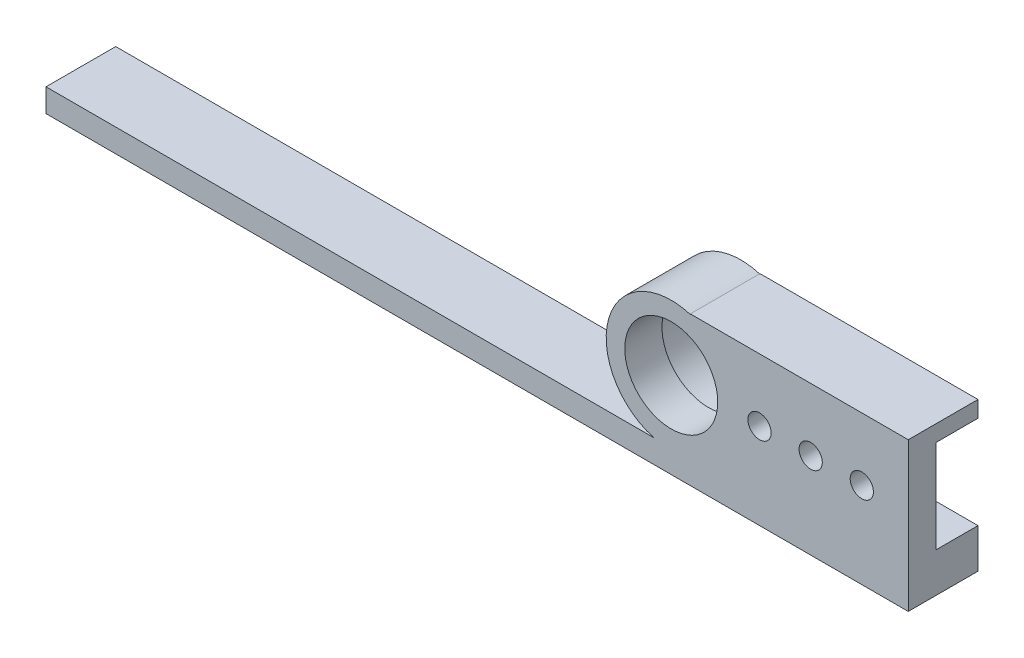
from build123d import *

# Parameters (mm, degrees)
SKETCH_1_W          = 40
SKETCH_1_H          = 20
EXTRUDE_1_DEPTH     = 6
SKETCH_2_R          = 2.5
CUT_EXTRUDE_1_DEPTH = 24.151673806
EXTRUDE_START       = -15
EXTRUDE_2_OUTLINE_R = 11
EXTRUDE_2_DEPTH     = 15
EXTRUDE_START_2     = -8
SKETCH_5_R          = 11
SKETCH_5_R_2        = 10
EXTRUDE_3_DEPTH     = 8
SKETCH_10_W         = 15
SKETCH_10_H         = 5
EXTRUDE_4_DEPTH     = 500
SKETCH_11_W         = 11.491200589
SKETCH_11_H         = 5.122583395
EXTRUDE_5_DEPTH     = 15
SKETCH_13_W         = 324.526705223
SKETCH_13_H         = 235.156452348
CUT_EXTRUDE_2_DEPTH = 482.183177179
SKETCH_14_W         = 2.170521585
SKETCH_14_H         = 5
CUT_EXTRUDE_3_DEPTH = 314.479535155


# Read off the part's stored shape, not the designer's step: 凸台-拉伸2
with BuildPart() as part:
    # 草图1 → 凸台-拉伸1 (new body)
    with BuildSketch(Plane.XY):
        Rectangle(SKETCH_1_W, SKETCH_1_H)
    extrude(amount=EXTRUDE_1_DEPTH)

    # 草图2 → 切除-拉伸1 (cut, through all)
    with BuildSketch(Plane.XY.offset(6)):
        with Locations((10, 0)):
            Circle(SKETCH_2_R)
        with Locations((-1, 0)):
            Circle(SKETCH_2_R)
        with Locations((-12, 0)):
            Circle(SKETCH_2_R)
    extrude(amount=-CUT_EXTRUDE_1_DEPTH, mode=Mode.SUBTRACT)

    # 凸台-拉伸2 outline → 凸台-拉伸2 (add)
    with BuildSketch(Plane.XY.offset(6).offset(EXTRUDE_START)):
        with BuildLine():
            Line((20, 10), (20, 13.5))
            Line((20, 13.5), (-26.893967141, 13.5))
            Line((-26.893967141, 13.5), (-26.893967141, 13.384337644))
            ThreePointArc((-26.893967141, 13.384337644), (-45, 0), (-26.893967141, -13.384337644))
            Line((-26.893967141, -13.384337644), (-26.893967141, -13.5))
            Line((-26.893967141, -13.5), (20, -13.5))
            Line((20, -13.5), (20, -10))
            Line((20, -10), (-20, -10))
            Line((-20, -10), (-20, -8.660254038))
            ThreePointArc((-20, -8.660254038), (-17, 0), (-20, 8.660254038))
            Line((-20, 8.660254038), (-20, 10))
            Line((-20, 10), (20, 10))
        make_face()
        with Locations((-31, 0)):
            Circle(EXTRUDE_2_OUTLINE_R, mode=Mode.SUBTRACT)
    extrude(amount=EXTRUDE_2_DEPTH)

    # 草图5 → 凸台-拉伸3 (add)
    with BuildSketch(Plane.XY.offset(6).offset(EXTRUDE_START_2)):
        with Locations((-31, 0)):
            Circle(SKETCH_5_R)
        with Locations((-31, 0)):
            Circle(SKETCH_5_R_2, mode=Mode.SUBTRACT)
    extrude(amount=EXTRUDE_3_DEPTH)

    # 草图10 → 凸台-拉伸4 (add)
    with BuildSketch(Plane(origin=(20, 0, 0), x_dir=(0, 0, -1), z_dir=(1, 0, 0))):
        with Locations((1.5, -16)):
            Rectangle(SKETCH_10_W, SKETCH_10_H)
    extrude(amount=-EXTRUDE_4_DEPTH)

    # 草图11 → 凸台-拉伸5 (add, through all)
    with BuildSketch(Plane(origin=(0, 0, -9), x_dir=(-1, 0, 0), z_dir=(0, 0, -1))):
        with Locations((27.78271332, -13.925059853)):
            Rectangle(SKETCH_11_W, SKETCH_11_H)
    extrude(amount=-EXTRUDE_5_DEPTH)

    # 草图13 → 切除-拉伸2 (cut, through all)
    with BuildSketch(Plane.XZ.offset(18.5)):
        with Locations((-327.783817457, -102.630695063)):
            Rectangle(SKETCH_13_W, SKETCH_13_H)
    extrude(amount=-CUT_EXTRUDE_2_DEPTH, mode=Mode.SUBTRACT)

    # 草图14 → 切除-拉伸3 (cut)
    with BuildSketch(Plane.ZY.offset(480)):
        with Locations((-7.914739208, -16)):
            Rectangle(SKETCH_14_W, SKETCH_14_H)
    extrude(amount=-CUT_EXTRUDE_3_DEPTH, mode=Mode.SUBTRACT)


solid = part.part
